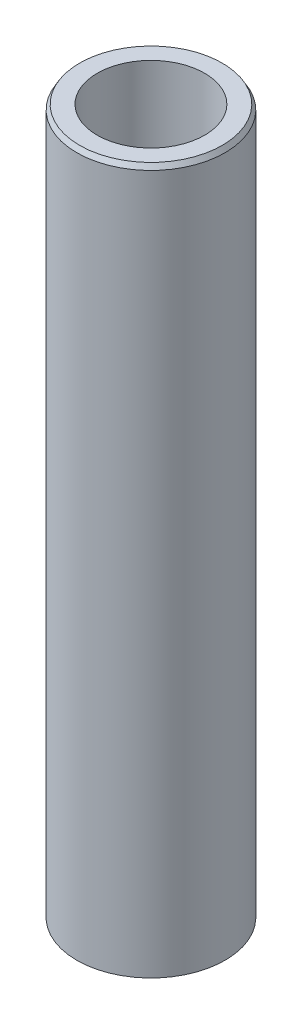
from build123d import *
from OCP.BRepFilletAPI import BRepFilletAPI_MakeChamfer

# Parameters (mm, degrees)
SKETCH1_R           = 40
BOSS_EXTRUDE1_DEPTH = 381.434596674
SKETCH2_R           = 28.972981057
CUT_EXTRUDE1_DEPTH  = 386.606472378
CHAMFER1_SIZE       = 2.659651992
CHAMFER1_SIZE2      = 1.535550794


with BuildPart() as part:
    # Sketch1 → Boss-Extrude1 (new body)
    with BuildSketch(Plane(origin=(0, 0, 0), x_dir=(1, 0, 0), z_dir=(0, 1, 0))):
        Circle(SKETCH1_R)
    extrude(amount=BOSS_EXTRUDE1_DEPTH)

    # Sketch2 → Cut-Extrude1 (cut, through all)
    with BuildSketch(Plane(origin=(0, 0, 0), x_dir=(1, 0, 0), z_dir=(0, 1, 0))):
        Circle(SKETCH2_R)
    extrude(amount=CUT_EXTRUDE1_DEPTH, mode=Mode.SUBTRACT)

    # Chamfer1: one chamfer whose edges measure the first distance from different faces: ONE call of the kernel's chamfer builder (chamfer() names one face for all edges)
    chamfer1_edges_1 = [part.edges().sort_by_distance(p)[0] for p in [
        (-40, 381.434596674, 0),
    ]]
    chamfer1_side_1 = [part.faces().sort_by_distance(p)[0] for p in [
        (-40, 190.717298337, 0),
    ]]
    chamfer1_edges_2 = [part.edges().sort_by_distance(p)[0] for p in [
        (-40, 0, 0),
    ]]
    chamfer1_side_2 = [part.faces().sort_by_distance(p)[0] for p in [
        (-38.86862915, 0, 0),
    ]]
    chamfer1 = BRepFilletAPI_MakeChamfer(part.part.solid().wrapped)
    for e in chamfer1_edges_1:
        chamfer1.Add(CHAMFER1_SIZE, CHAMFER1_SIZE2, e.wrapped, chamfer1_side_1[0].wrapped)  # the first distance lies on this face
    for e in chamfer1_edges_2:
        chamfer1.Add(CHAMFER1_SIZE, CHAMFER1_SIZE2, e.wrapped, chamfer1_side_2[0].wrapped)  # the first distance lies on this face
    add(Compound.cast(chamfer1.Shape()), mode=Mode.REPLACE)


solid = part.part
